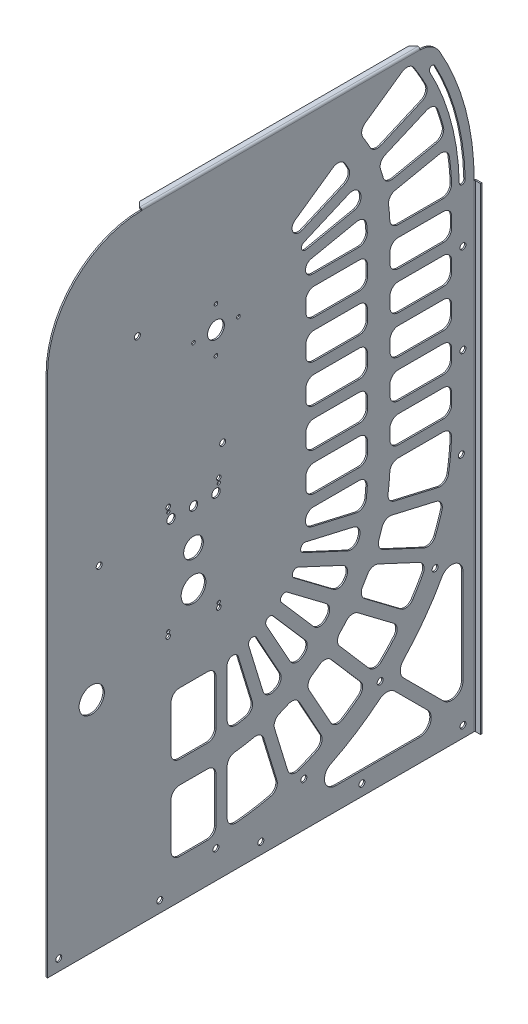
from build123d import *

# Parameters (mm, degrees)
SKETCH1_W             = 482.6
SKETCH1_H             = 698.5
BASE_FLANGE1_DEPTH    = 1.5875
SKETCH7_R             = 9.525
BEARING_HOLES_DEPTH   = 850.003845784
SKETCH9_R             = 3.3782
CUT_EXTRUDE2_DEPTH    = 850.003845784
CRVPATTERN1_START     = -1.5875
CRVPATTERN1_OUTLINE_R = 3.3782
CRVPATTERN1_DEPTH     = 1.5875
CUT_EXTRUDE3_DEPTH    = 850.003845784
CUT_EXTRUDE4_REACH    = 851.004
SKETCH12_R            = 4.7625
SKETCH13_R            = 3.3782
CUT_EXTRUDE5_DEPTH    = 850.003845784
CUT_EXTRUDE7_DEPTH    = 2.54
FILLET1_R             = 25.4
FILLET2_R             = 106.68
SKETCH26_R            = 3.3782
CUT_EXTRUDE9_DEPTH    = 850.003845784
CUT_EXTRUDE8_DEPTH    = 850.003845784
EDGE_FLANGE2_DEPTH    = 539.75
CUT_EXTRUDE10_DEPTH   = 850.039465459
SKETCH28_R            = 14.2875
CUT_EXTRUDE11_DEPTH   = 850.039465459
EDGE_FLANGE3_DEPTH    = 314.788975189
BREAK_CORNER1_START   = 699.2366
BREAK_CORNER1_DEPTH   = 1.5875


# Read off the part's stored shape, not the designer's step: CrvPattern1, Break-Corner1
# Sheet-metal steps are written as plain solids
with BuildPart() as part:
    # Sketch1 → Base-Flange1 (new body)
    with BuildSketch(Plane(origin=(0, 0, 0), x_dir=(0, 0, -1), z_dir=(1, 0, 0))):
        with Locations((-241.3, 349.25)):
            Rectangle(SKETCH1_W, SKETCH1_H)
    extrude(amount=-BASE_FLANGE1_DEPTH)

    # Sketch7 → Bearing Holes (cut, through all)
    with BuildSketch(Plane(origin=(0, 0, 0), x_dir=(0, 0, -1), z_dir=(1, 0, 0))):
        with Locations((-292.1, 539.75)):
            Circle(SKETCH7_R)
        with BuildLine():
            ThreePointArc((-315.4807, 539.75), (-317.5, 541.7693), (-319.5193, 539.75))
            ThreePointArc((-319.5193, 539.75), (-317.5, 537.7307), (-315.4807, 539.75))
        make_face()
        with BuildLine():
            ThreePointArc((-294.1193, 514.35), (-292.1, 512.3307), (-290.0807, 514.35))
            ThreePointArc((-290.0807, 514.35), (-292.1, 516.3693), (-294.1193, 514.35))
        make_face()
        with BuildLine():
            ThreePointArc((-268.7193, 539.75), (-266.7, 537.7307), (-264.6807, 539.75))
            ThreePointArc((-264.6807, 539.75), (-266.7, 541.7693), (-268.7193, 539.75))
        make_face()
        with BuildLine():
            ThreePointArc((-294.1193, 565.15), (-292.1, 563.1307), (-290.0807, 565.15))
            ThreePointArc((-290.0807, 565.15), (-292.1, 567.1693), (-294.1193, 565.15))
        make_face()
    extrude(amount=-BEARING_HOLES_DEPTH, mode=Mode.SUBTRACT)

    # Sketch9 → Cut-Extrude2 (cut, through all)
    with BuildSketch(Plane(origin=(0, 0, 0), x_dir=(0, 0, -1), z_dir=(1, 0, 0))):
        with Locations((-292.1, 31.75)):
            Circle(SKETCH9_R)
    extrude(amount=-CUT_EXTRUDE2_DEPTH, mode=Mode.SUBTRACT)

    # CrvPattern1 outline → CrvPattern1 (cut)
    with BuildSketch(Plane.YZ.offset(CRVPATTERN1_START)):
        with Locations((481.869506294, 12.7)):
            Circle(CRVPATTERN1_OUTLINE_R)
        with Locations((380.269506294, 12.7)):
            Circle(CRVPATTERN1_OUTLINE_R)
        with Locations((278.74261521, 14.58581764)):
            Circle(CRVPATTERN1_OUTLINE_R)
        with Locations((182.156845096, 44.259071201)):
            Circle(CRVPATTERN1_OUTLINE_R)
        with Locations((102.440892256, 106.345139108)):
            Circle(CRVPATTERN1_OUTLINE_R)
        with Locations((50.020066151, 192.724360892)):
            Circle(CRVPATTERN1_OUTLINE_R)
    extrude(amount=CRVPATTERN1_DEPTH, mode=Mode.SUBTRACT)

    # Sketch11 → Cut-Extrude3 (cut, through all)
    with BuildSketch(Plane(origin=(0, 0, 0), x_dir=(0, 0, -1), z_dir=(1, 0, 0))):
        with BuildLine():
            ThreePointArc((-10.148177306, 546.176984789), (-19.619450406, 612.499477987), (-44.466941645, 674.716680569))
            ThreePointArc((-44.466941645, 674.716680569), (-49.04986212, 676.066239905), (-50.399421456, 671.483319431))
            ThreePointArc((-50.399421456, 671.483319431), (-26.147195006, 610.756637946), (-16.902822694, 546.023015211))
            ThreePointArc((-16.902822694, 546.023015211), (-13.448515211, 542.722677306), (-10.148177306, 546.176984789))
        make_face()
    extrude(amount=-CUT_EXTRUDE3_DEPTH, mode=Mode.SUBTRACT)

    # Sketch12 → Cut-Extrude4 (cut, up to next)
    with BuildSketch(Plane(origin=(0, 0, 0), x_dir=(0, 0, -1), z_dir=(1, 0, 0)), mode=Mode.PRIVATE) as cut_extrude4_sk1:
        with Locations((-342.9, 379.8824)):
            Circle(SKETCH12_R)
    cut_extrude4_tool1 = extrude(cut_extrude4_sk1.sketch, amount=-CUT_EXTRUDE4_REACH, mode=Mode.PRIVATE) & part.part
    # Sketch12 → Cut-Extrude4 (cut, up to next)
    with BuildSketch(Plane(origin=(0, 0, 0), x_dir=(0, 0, -1), z_dir=(1, 0, 0)), mode=Mode.PRIVATE) as cut_extrude4_sk2:
        with Locations((-292.1, 379.8824)):
            Circle(SKETCH12_R)
    cut_extrude4_tool2 = extrude(cut_extrude4_sk2.sketch, amount=-CUT_EXTRUDE4_REACH, mode=Mode.PRIVATE) & part.part
    # Sketch12 → Cut-Extrude4 (cut, up to next)
    with BuildSketch(Plane(origin=(0, 0, 0), x_dir=(0, 0, -1), z_dir=(1, 0, 0)), mode=Mode.PRIVATE) as cut_extrude4_sk3:
        with Locations((-317.5, 379.8824)):
            Circle(SKETCH12_R)
    cut_extrude4_tool3 = extrude(cut_extrude4_sk3.sketch, amount=-CUT_EXTRUDE4_REACH, mode=Mode.PRIVATE) & part.part
    # Sketch12 → Cut-Extrude4 (cut, up to next)
    with BuildSketch(Plane(origin=(0, 0, 0), x_dir=(0, 0, -1), z_dir=(1, 0, 0)), mode=Mode.PRIVATE) as cut_extrude4_sk4:
        with BuildLine():
            ThreePointArc((-347.896015918, 388.0612), (-346.075, 386.240184083), (-344.253984083, 388.0612))
            ThreePointArc((-344.253984083, 388.0612), (-346.075, 389.882215918), (-347.896015918, 388.0612))
        make_face()
    cut_extrude4_tool4 = extrude(cut_extrude4_sk4.sketch, amount=-CUT_EXTRUDE4_REACH, mode=Mode.PRIVATE) & part.part
    # Sketch12 → Cut-Extrude4 (cut, up to next)
    with BuildSketch(Plane(origin=(0, 0, 0), x_dir=(0, 0, -1), z_dir=(1, 0, 0)), mode=Mode.PRIVATE) as cut_extrude4_sk5:
        with BuildLine():
            ThreePointArc((-348.6277, 393.1412), (-346.075, 390.5885), (-343.5223, 393.1412))
            ThreePointArc((-343.5223, 393.1412), (-346.075, 395.6939), (-348.6277, 393.1412))
        make_face()
    cut_extrude4_tool5 = extrude(cut_extrude4_sk5.sketch, amount=-CUT_EXTRUDE4_REACH, mode=Mode.PRIVATE) & part.part
    # Sketch12 → Cut-Extrude4 (cut, up to next)
    with BuildSketch(Plane(origin=(0, 0, 0), x_dir=(0, 0, -1), z_dir=(1, 0, 0)), mode=Mode.PRIVATE) as cut_extrude4_sk6:
        with BuildLine():
            ThreePointArc((-344.253984083, 271.2212), (-346.075, 273.042215918), (-347.896015918, 271.2212))
            ThreePointArc((-347.896015918, 271.2212), (-346.075, 269.400184083), (-344.253984083, 271.2212))
        make_face()
    cut_extrude4_tool6 = extrude(cut_extrude4_sk6.sketch, amount=-CUT_EXTRUDE4_REACH, mode=Mode.PRIVATE) & part.part
    # Sketch12 → Cut-Extrude4 (cut, up to next)
    with BuildSketch(Plane(origin=(0, 0, 0), x_dir=(0, 0, -1), z_dir=(1, 0, 0)), mode=Mode.PRIVATE) as cut_extrude4_sk7:
        with BuildLine():
            ThreePointArc((-343.5223, 266.1412), (-346.075, 268.6939), (-348.6277, 266.1412))
            ThreePointArc((-348.6277, 266.1412), (-346.075, 263.5885), (-343.5223, 266.1412))
        make_face()
    cut_extrude4_tool7 = extrude(cut_extrude4_sk7.sketch, amount=-CUT_EXTRUDE4_REACH, mode=Mode.PRIVATE) & part.part
    # Sketch12 → Cut-Extrude4 (cut, up to next)
    with BuildSketch(Plane(origin=(0, 0, 0), x_dir=(0, 0, -1), z_dir=(1, 0, 0)), mode=Mode.PRIVATE) as cut_extrude4_sk8:
        with BuildLine():
            ThreePointArc((-287.103984083, 271.2212), (-288.925, 273.042215918), (-290.746015918, 271.2212))
            ThreePointArc((-290.746015918, 271.2212), (-288.925, 269.400184083), (-287.103984083, 271.2212))
        make_face()
    cut_extrude4_tool8 = extrude(cut_extrude4_sk8.sketch, amount=-CUT_EXTRUDE4_REACH, mode=Mode.PRIVATE) & part.part
    # Sketch12 → Cut-Extrude4 (cut, up to next)
    with BuildSketch(Plane(origin=(0, 0, 0), x_dir=(0, 0, -1), z_dir=(1, 0, 0)), mode=Mode.PRIVATE) as cut_extrude4_sk9:
        with BuildLine():
            ThreePointArc((-291.4777, 266.1412), (-288.925, 263.5885), (-286.3723, 266.1412))
            ThreePointArc((-286.3723, 266.1412), (-288.925, 268.6939), (-291.4777, 266.1412))
        make_face()
    cut_extrude4_tool9 = extrude(cut_extrude4_sk9.sketch, amount=-CUT_EXTRUDE4_REACH, mode=Mode.PRIVATE) & part.part
    # Sketch12 → Cut-Extrude4 (cut, up to next)
    with BuildSketch(Plane(origin=(0, 0, 0), x_dir=(0, 0, -1), z_dir=(1, 0, 0)), mode=Mode.PRIVATE) as cut_extrude4_sk10:
        with BuildLine():
            ThreePointArc((-286.3723, 393.1412), (-288.925, 395.6939), (-291.4777, 393.1412))
            ThreePointArc((-291.4777, 393.1412), (-288.925, 390.5885), (-286.3723, 393.1412))
        make_face()
    cut_extrude4_tool10 = extrude(cut_extrude4_sk10.sketch, amount=-CUT_EXTRUDE4_REACH, mode=Mode.PRIVATE) & part.part
    # Sketch12 → Cut-Extrude4 (cut, up to next)
    with BuildSketch(Plane(origin=(0, 0, 0), x_dir=(0, 0, -1), z_dir=(1, 0, 0)), mode=Mode.PRIVATE) as cut_extrude4_sk11:
        with BuildLine():
            ThreePointArc((-290.746015918, 388.0612), (-288.925, 386.240184083), (-287.103984083, 388.0612))
            ThreePointArc((-287.103984083, 388.0612), (-288.925, 389.882215918), (-290.746015918, 388.0612))
        make_face()
    cut_extrude4_tool11 = extrude(cut_extrude4_sk11.sketch, amount=-CUT_EXTRUDE4_REACH, mode=Mode.PRIVATE) & part.part
    # Sketch12 → Cut-Extrude4 (cut, up to next)
    with BuildSketch(Plane(origin=(0, 0, 0), x_dir=(0, 0, -1), z_dir=(1, 0, 0)), mode=Mode.PRIVATE) as cut_extrude4_sk12:
        with BuildLine():
            ThreePointArc((-324.485, 310.548374891), (-329.598374891, 291.465), (-310.515, 286.351625109))
            ThreePointArc((-310.515, 286.351625109), (-305.401625109, 305.435), (-324.485, 310.548374891))
        make_face()
    cut_extrude4_tool12 = extrude(cut_extrude4_sk12.sketch, amount=-CUT_EXTRUDE4_REACH, mode=Mode.PRIVATE) & part.part
    # Sketch12 → Cut-Extrude4 (cut, up to next)
    with BuildSketch(Plane(origin=(0, 0, 0), x_dir=(0, 0, -1), z_dir=(1, 0, 0)), mode=Mode.PRIVATE) as cut_extrude4_sk13:
        with BuildLine():
            ThreePointArc((-328.448691084, 341.081764815), (-319.415564815, 328.217508917), (-306.551308917, 337.250635185))
            ThreePointArc((-306.551308917, 337.250635185), (-315.584435185, 350.114891084), (-328.448691084, 341.081764815))
        make_face()
    cut_extrude4_tool13 = extrude(cut_extrude4_sk13.sketch, amount=-CUT_EXTRUDE4_REACH, mode=Mode.PRIVATE) & part.part
    add(cut_extrude4_tool1.solids().sort_by_distance((0, 379.8824, 342.9))[0], mode=Mode.SUBTRACT)
    add(cut_extrude4_tool2.solids().sort_by_distance((0, 379.8824, 292.1))[0], mode=Mode.SUBTRACT)
    add(cut_extrude4_tool3.solids().sort_by_distance((0, 379.8824, 317.5))[0], mode=Mode.SUBTRACT)
    add(cut_extrude4_tool4.solids().sort_by_distance((0, 388.0612, 346.075))[0], mode=Mode.SUBTRACT)
    add(cut_extrude4_tool5.solids().sort_by_distance((0, 393.1412, 346.075))[0], mode=Mode.SUBTRACT)
    add(cut_extrude4_tool6.solids().sort_by_distance((0, 271.2212, 346.075))[0], mode=Mode.SUBTRACT)
    add(cut_extrude4_tool7.solids().sort_by_distance((0, 266.1412, 346.075))[0], mode=Mode.SUBTRACT)
    add(cut_extrude4_tool8.solids().sort_by_distance((0, 271.2212, 288.925))[0], mode=Mode.SUBTRACT)
    add(cut_extrude4_tool9.solids().sort_by_distance((0, 266.1412, 288.925))[0], mode=Mode.SUBTRACT)
    add(cut_extrude4_tool10.solids().sort_by_distance((0, 393.1412, 288.925))[0], mode=Mode.SUBTRACT)
    add(cut_extrude4_tool11.solids().sort_by_distance((0, 388.0612, 288.925))[0], mode=Mode.SUBTRACT)
    add(cut_extrude4_tool12.solids().sort_by_distance((0, 298.45, 317.5))[0], mode=Mode.SUBTRACT)
    add(cut_extrude4_tool13.solids().sort_by_distance((0, 339.1662, 317.5))[0], mode=Mode.SUBTRACT)

    # Sketch13 → Cut-Extrude5 (cut, through all)
    with BuildSketch(Plane.ZY.offset(1.5875)):
        with Locations((381, 577.85)):
            Circle(SKETCH13_R)
        with Locations((284.48, 425.45)):
            Circle(SKETCH13_R)
        with Locations((424.18, 374.65)):
            Circle(SKETCH13_R)
    extrude(amount=-CUT_EXTRUDE5_DEPTH, mode=Mode.SUBTRACT)

    # Sketch18 → Cut-Extrude7 (cut)
    with BuildSketch(Plane(origin=(0, 0, 0), x_dir=(0, 0, -1), z_dir=(1, 0, 0))):
        with BuildLine():
            Line((-46.904470881, 698.5), (0, 698.5))
            Line((0, 698.5), (0, 539.75))
            ThreePointArc((0, 539.75), (-11.971436608, 622.517130989), (-46.904470881, 698.5))
        make_face()
    extrude(amount=-CUT_EXTRUDE7_DEPTH, mode=Mode.SUBTRACT)

    # Fillet1
    fillet1_edges = [part.edges().sort_by_distance(p)[0] for p in [
        (-0.79375, 698.5, 46.904470881),
    ]]
    fillet(fillet1_edges, radius=FILLET1_R)

    # Fillet2
    fillet2_edges = [part.edges().sort_by_distance(p)[0] for p in [
        (-0.79375, 698.5, 482.6),
    ]]
    fillet(fillet2_edges, radius=FILLET2_R)

    # Sketch26 → Cut-Extrude9 (cut, through all)
    with BuildSketch(Plane.ZY.offset(1.5875)):
        with Locations((12.7, 12.7)):
            Circle(SKETCH26_R)
        with Locations((127, 12.7)):
            Circle(SKETCH26_R)
        with Locations((241.3, 12.7)):
            Circle(SKETCH26_R)
        with Locations((355.6, 12.7)):
            Circle(SKETCH26_R)
        with Locations((469.9, 12.7)):
            Circle(SKETCH26_R)
    extrude(amount=-CUT_EXTRUDE9_DEPTH, mode=Mode.SUBTRACT)

    # Sketch19 → Cut-Extrude8 (cut, through all)
    with BuildSketch(Plane(origin=(0, 0, 0), x_dir=(0, 0, -1), z_dir=(1, 0, 0))):
        with BuildLine():
            Line((-156.649870801, 25.4), (-61.321024484, 25.4))
            ThreePointArc((-61.321024484, 25.4), (-49.587754421, 33.239920409), (-52.340768363, 47.080256121))
            Line((-52.340768363, 47.080256121), (-89.767936864, 84.507424621))
            ThreePointArc((-89.767936864, 84.507424621), (-98.124730264, 88.211855892), (-106.804518277, 85.34478648))
            ThreePointArc((-106.804518277, 85.34478648), (-133.53166182, 65.836950761), (-162.293626184, 49.477083333))
            ThreePointArc((-162.293626184, 49.477083333), (-169.014719331, 35.2016348), (-156.649870801, 25.4))
        make_face()
        with BuildLine():
            Line((-12.7, 163.589334509), (-12.7, 56.060512242))
            ThreePointArc((-12.7, 56.060512242), (-20.539920409, 44.327242179), (-34.380256121, 47.080256121))
            Line((-34.380256121, 47.080256121), (-79.827050366, 92.527050366))
            ThreePointArc((-79.827050366, 92.527050366), (-83.545642238, 101.336251972), (-80.065677818, 110.242418717))
            ThreePointArc((-80.065677818, 110.242418717), (-56.404297585, 138.610306414), (-36.5125, 169.737695572))
            ThreePointArc((-36.5125, 169.737695572), (-22.225, 175.886056634), (-12.7, 163.589334509))
        make_face()
    extrude(amount=-CUT_EXTRUDE8_DEPTH, mode=Mode.SUBTRACT)

    # Edge-Flange2 section (across the edge) → Edge-Flange2 (add)
    with BuildSketch(Plane(origin=(0, 0, -0.7366), x_dir=(0, 0, 1), z_dir=(0, 1, 0))):
        with BuildLine():
            Line((-1.5875, 0.7366), (-1.5875, 6.35))
            Line((-1.5875, 6.35), (0, 6.35))
            Line((0, 6.35), (0, 0.7366))
            ThreePointArc((0, 0.7366), (0.215745145, 0.215745145), (0.7366, 0))
            Line((0.7366, 0), (0.7366, -1.5875))
            ThreePointArc((0.7366, -1.5875), (-0.90678687, -0.90678687), (-1.5875, 0.7366))
        make_face()
    extrude(amount=EDGE_FLANGE2_DEPTH)

    # Sketch27 → Cut-Extrude10 (cut, through all)
    with BuildSketch(Plane.ZY.offset(1.5875)):
        with BuildLine():
            Line((333.375, 114.3), (301.625, 114.3))
            ThreePointArc((301.625, 114.3), (294.889807909, 111.510192091), (292.1, 104.775))
            Line((292.1, 104.775), (292.1, 53.975))
            ThreePointArc((292.1, 53.975), (294.889807909, 47.239807909), (301.625, 44.45))
            Line((301.625, 44.45), (333.375, 44.45))
            ThreePointArc((333.375, 44.45), (340.110192091, 47.239807909), (342.9, 53.975))
            Line((342.9, 53.975), (342.9, 104.775))
            ThreePointArc((342.9, 104.775), (340.110192091, 111.510192091), (333.375, 114.3))
        make_face()
        with BuildLine():
            Line((279.4, 54.937139277), (279.4, 105.975220848))
            ThreePointArc((279.4, 105.975220848), (276.963585082, 112.337420667), (270.900769231, 115.44482604))
            ThreePointArc((270.900769231, 115.44482604), (259.999148252, 116.935021646), (249.197819666, 119.032001305))
            ThreePointArc((249.197819666, 119.032001305), (242.329800372, 117.967696281), (238.013104914, 112.520809597))
            Line((238.013104914, 112.520809597), (223.125231873, 63.824771077))
            ThreePointArc((223.125231873, 63.824771077), (223.966051137, 56.31065229), (230.016776699, 51.776594685))
            ThreePointArc((230.016776699, 51.776594685), (249.416852344, 47.887699421), (269.051851852, 45.447774065))
            ThreePointArc((269.051851852, 45.447774065), (276.312590345, 47.916950137), (279.4, 54.937139277))
        make_face()
        with BuildLine():
            Line((210.980161472, 67.537891727), (225.868034514, 116.233930247))
            ThreePointArc((225.868034514, 116.233930247), (225.335192169, 123.163469428), (220.236497942, 127.886365932))
            ThreePointArc((220.236497942, 127.886365932), (215.184577357, 129.948619598), (210.191757295, 132.150105371))
            ThreePointArc((210.191757295, 132.150105371), (203.252539243, 132.53699947), (197.897702518, 128.10663178))
            Line((197.897702518, 128.10663178), (173.210689518, 83.570081393))
            ThreePointArc((173.210689518, 83.570081393), (172.470861722, 76.045347975), (177.44668083, 70.352353825))
            ThreePointArc((177.44668083, 70.352353825), (187.892008032, 65.651355584), (198.529557141, 61.403203778))
            ThreePointArc((198.529557141, 61.403203778), (206.081248809, 61.778585093), (210.980161472, 67.537891727))
        make_face()
        with BuildLine():
            Line((301.625, 139.7), (333.375, 139.7))
            ThreePointArc((333.375, 139.7), (340.110192091, 142.489807909), (342.9, 149.225))
            Line((342.9, 149.225), (342.9, 200.025))
            ThreePointArc((342.9, 200.025), (340.110192091, 206.760192091), (333.375, 209.55))
            Line((333.375, 209.55), (301.625, 209.55))
            ThreePointArc((301.625, 209.55), (294.889807909, 206.760192091), (292.1, 200.025))
            Line((292.1, 200.025), (292.1, 149.225))
            ThreePointArc((292.1, 149.225), (294.889807909, 142.489807909), (301.625, 139.7))
        make_face()
        with BuildLine():
            Line((279.4, 150.757497058), (279.4, 204.821575064))
            ThreePointArc((279.4, 204.821575064), (273.914615259, 211.187677432), (266.807647542, 206.703514748))
            Line((266.807647542, 206.703514748), (251.058315916, 155.189772161))
            ThreePointArc((251.058315916, 155.189772161), (251.986644049, 147.525847824), (258.288713935, 143.066986478))
            ThreePointArc((258.288713935, 143.066986478), (263.414918227, 142.116664283), (268.567647059, 141.322643944))
            ThreePointArc((268.567647059, 141.322643944), (276.130920725, 143.574943133), (279.4, 150.757497058))
        make_face()
        with BuildLine():
            Line((238.913245515, 158.902892811), (255.098677828, 211.843056471))
            ThreePointArc((255.098677828, 211.843056471), (252.401717345, 217.626706889), (246.367841235, 215.549076729))
            Line((246.367841235, 215.549076729), (219.529220513, 167.130923261))
            ThreePointArc((219.529220513, 167.130923261), (218.843842981, 159.441463788), (224.081148119, 153.769765254))
            ThreePointArc((224.081148119, 153.769765254), (225.109148021, 153.329442876), (226.139998169, 152.895835257))
            ThreePointArc((226.139998169, 152.895835257), (233.858014512, 153.068326087), (238.913245515, 158.902892811))
        make_face()
        with BuildLine():
            Line((162.103019238, 89.72716357), (186.790032238, 134.263713957))
            ThreePointArc((186.790032238, 134.263713957), (187.709565985, 141.152610234), (183.704235857, 146.832378255))
            ThreePointArc((183.704235857, 146.832378255), (179.191478504, 149.899920082), (174.76547817, 153.09136377))
            ThreePointArc((174.76547817, 153.09136377), (168.058338487, 154.912547862), (161.899392555, 151.692327494))
            Line((161.899392555, 151.692327494), (128.492180526, 113.261726202))
            ThreePointArc((128.492180526, 113.261726202), (126.204039694, 106.055245111), (129.887485176, 99.452125578))
            ThreePointArc((129.887485176, 99.452125578), (139.127164425, 92.682149788), (148.649017139, 86.31515947))
            ThreePointArc((148.649017139, 86.31515947), (156.11373239, 85.112252819), (162.103019238, 89.72716357))
        make_face()
        with BuildLine():
            Line((208.421550232, 173.288005439), (235.260170954, 221.706158906))
            ThreePointArc((235.260170954, 221.706158906), (233.824634067, 227.9241523), (227.490649026, 227.146436728))
            Line((227.490649026, 227.146436728), (191.171816407, 185.366399095))
            ThreePointArc((191.171816407, 185.366399095), (188.902687498, 177.987470761), (192.84633252, 171.350815482))
            ThreePointArc((192.84633252, 171.350815482), (193.760319988, 170.706382007), (194.678491494, 170.067923958))
            ThreePointArc((194.678491494, 170.067923958), (202.263713522, 168.631979621), (208.421550232, 173.288005439))
        make_face()
        with BuildLine():
            Line((118.907368857, 121.59367587), (152.314580886, 160.024277162))
            ThreePointArc((152.314580886, 160.024277162), (154.646302687, 166.57145271), (151.909388806, 172.959859133))
            ThreePointArc((151.909388806, 172.959859133), (148.133023836, 176.898622822), (144.467280681, 180.940543022))
            ThreePointArc((144.467280681, 180.940543022), (138.285353557, 184.116422624), (131.591473909, 182.247088659))
            Line((131.591473909, 182.247088659), (90.924118321, 151.602038149))
            ThreePointArc((90.924118321, 151.602038149), (87.187667188, 145.028767189), (89.417754803, 137.804110283))
            ThreePointArc((89.417754803, 137.804110283), (97.047967778, 129.261037371), (105.037973442, 121.05347657))
            ThreePointArc((105.037973442, 121.05347657), (112.089468399, 118.324854747), (118.907368857, 121.59367587))
        make_face()
        with BuildLine():
            Line((181.587004738, 193.698348764), (217.905837358, 235.478386396))
            ThreePointArc((217.905837358, 235.478386396), (217.794463915, 241.858966618), (211.437195486, 242.415155536))
            Line((211.437195486, 242.415155536), (167.22545823, 209.099221866))
            ThreePointArc((167.22545823, 209.099221866), (163.471749766, 202.353319248), (165.949378463, 195.041760905))
            ThreePointArc((165.949378463, 195.041760905), (166.709407857, 194.221381167), (167.474772221, 193.405976368))
            ThreePointArc((167.474772221, 193.405976368), (174.595689334, 190.424354523), (181.587004738, 193.698348764))
        make_face()
        with BuildLine():
            Line((83.281067527, 161.744709126), (123.948423115, 192.389759637))
            ThreePointArc((123.948423115, 192.389759637), (127.590425539, 198.309071468), (126.241544173, 205.126912276))
            ThreePointArc((126.241544173, 205.126912276), (123.366616857, 209.764754954), (120.621341448, 214.480500357))
            ThreePointArc((120.621341448, 214.480500357), (115.234806761, 218.872274291), (108.298548059, 218.435525594))
            Line((108.298548059, 218.435525594), (62.148407496, 196.915361625))
            ThreePointArc((62.148407496, 196.915361625), (57.126946905, 191.262584279), (57.806211122, 183.732142174))
            ThreePointArc((57.806211122, 183.732142174), (63.493480903, 173.789345421), (69.602437929, 164.099923929))
            ThreePointArc((69.602437929, 164.099923929), (75.932528426, 159.964840799), (83.281067527, 161.744709126))
        make_face()
        with BuildLine():
            Line((159.582407436, 219.241892843), (203.794144692, 252.557826514))
            ThreePointArc((203.794144692, 252.557826514), (205.011802249, 258.822131589), (198.909093565, 260.687916874))
            Line((198.909093565, 260.687916874), (148.736716744, 237.292153334))
            ThreePointArc((148.736716744, 237.292153334), (143.662483797, 231.474104748), (144.565811904, 223.807193525))
            ThreePointArc((144.565811904, 223.807193525), (145.138666295, 222.846722057), (145.71777342, 221.89000761))
            ThreePointArc((145.71777342, 221.89000761), (152.06316737, 217.493019439), (159.582407436, 219.241892843))
        make_face()
        with BuildLine():
            Line((56.781155572, 208.42547052), (102.931296135, 229.94563449))
            ThreePointArc((102.931296135, 229.94563449), (107.724406198, 234.978380274), (107.822509937, 241.927683108))
            ThreePointArc((107.822509937, 241.927683108), (105.974668393, 247.061908795), (104.269842439, 252.245378699))
            ThreePointArc((104.269842439, 252.245378699), (99.914117603, 257.66110537), (93.038627635, 258.676029955))
            Line((93.038627635, 258.676029955), (43.422684692, 247.221286956))
            ThreePointArc((43.422684692, 247.221286956), (37.335676568, 242.73605672), (36.434430281, 235.22894587))
            ThreePointArc((36.434430281, 235.22894587), (39.930195888, 224.320973206), (43.891113541, 213.573165236))
            ThreePointArc((43.891113541, 213.573165236), (49.223144248, 208.212343776), (56.781155572, 208.42547052))
        make_face()
        with BuildLine():
            Line((143.36946482, 248.80226223), (193.541841641, 272.198025769))
            ThreePointArc((193.541841641, 272.198025769), (196.035312719, 278.072275507), (190.453881436, 281.166113388))
            Line((190.453881436, 281.166113388), (136.51363867, 268.713027111))
            ThreePointArc((136.51363867, 268.713027111), (130.340649568, 264.077109197), (129.630197313, 256.389925906))
            ThreePointArc((129.630197313, 256.389925906), (129.990840213, 255.331339918), (130.35838034, 254.275128836))
            ThreePointArc((130.35838034, 254.275128836), (135.650926963, 248.654943821), (143.36946482, 248.80226223))
        make_face()
        with BuildLine():
            Line((40.565806302, 259.595786779), (90.181749245, 271.050529777))
            ThreePointArc((90.181749245, 271.050529777), (95.91648504, 274.976754374), (97.457286278, 281.753801353))
            ThreePointArc((97.457286278, 281.753801353), (96.195132975, 291.88330397), (95.459774496, 302.064615385))
            ThreePointArc((95.459774496, 302.064615385), (92.522853441, 308.513866436), (85.944924875, 311.15))
            Line((85.944924875, 311.15), (35.10144942, 311.15))
            ThreePointArc((35.10144942, 311.15), (28.242665515, 308.234289548), (25.582984584, 301.272222222))
            ThreePointArc((25.582984584, 301.272222222), (26.761442787, 284.236433609), (29.027708528, 267.310982448))
            ThreePointArc((29.027708528, 267.310982448), (33.128644118, 260.958716279), (40.565806302, 259.595786779))
        make_face()
        with BuildLine():
            Line((133.656760279, 281.087526934), (183.62473629, 292.62354317))
            ThreePointArc((183.62473629, 292.62354317), (190.837072188, 302.828762421), (181.513913161, 311.15))
            Line((181.513913161, 311.15), (130.455389821, 311.15))
            ThreePointArc((130.455389821, 311.15), (123.524934335, 308.159096094), (120.94688334, 301.064705882))
            ThreePointArc((120.94688334, 301.064705882), (121.403318948, 295.09554337), (122.067872162, 289.145954848))
            ThreePointArc((122.067872162, 289.145954848), (126.076261774, 282.548202043), (133.656760279, 281.087526934))
        make_face()
        with BuildLine():
            Line((130.175, 323.85), (180.975, 323.85))
            ThreePointArc((180.975, 323.85), (187.710192091, 326.639807909), (190.5, 333.375))
            Line((190.5, 333.375), (190.5, 344.805))
            ThreePointArc((190.5, 344.805), (187.710192091, 351.540192091), (180.975, 354.33))
            Line((180.975, 354.33), (130.175, 354.33))
            ThreePointArc((130.175, 354.33), (123.439807909, 351.540192091), (120.65, 344.805))
            Line((120.65, 344.805), (120.65, 333.375))
            ThreePointArc((120.65, 333.375), (123.439807909, 326.639807909), (130.175, 323.85))
        make_face()
        with BuildLine():
            Line((34.925, 323.85), (85.725, 323.85))
            ThreePointArc((85.725, 323.85), (92.460192091, 326.639807909), (95.25, 333.375))
            Line((95.25, 333.375), (95.25, 344.805))
            ThreePointArc((95.25, 344.805), (92.460192091, 351.540192091), (85.725, 354.33))
            Line((85.725, 354.33), (34.925, 354.33))
            ThreePointArc((34.925, 354.33), (28.189807909, 351.540192091), (25.4, 344.805))
            Line((25.4, 344.805), (25.4, 333.375))
            ThreePointArc((25.4, 333.375), (28.189807909, 326.639807909), (34.925, 323.85))
        make_face()
        with BuildLine():
            Line((95.25, 376.555), (95.25, 387.985))
            ThreePointArc((95.25, 387.985), (92.460192091, 394.720192091), (85.725, 397.51))
            Line((85.725, 397.51), (34.925, 397.51))
            ThreePointArc((34.925, 397.51), (28.189807909, 394.720192091), (25.4, 387.985))
            Line((25.4, 387.985), (25.4, 376.555))
            ThreePointArc((25.4, 376.555), (28.189807909, 369.819807909), (34.925, 367.03))
            Line((34.925, 367.03), (85.725, 367.03))
            ThreePointArc((85.725, 367.03), (92.460192091, 369.819807909), (95.25, 376.555))
        make_face()
        with BuildLine():
            Line((120.65, 387.985), (120.65, 376.555))
            ThreePointArc((120.65, 376.555), (123.439807909, 369.819807909), (130.175, 367.03))
            Line((130.175, 367.03), (180.975, 367.03))
            ThreePointArc((180.975, 367.03), (187.710192091, 369.819807909), (190.5, 376.555))
            Line((190.5, 376.555), (190.5, 387.985))
            ThreePointArc((190.5, 387.985), (187.710192091, 394.720192091), (180.975, 397.51))
            Line((180.975, 397.51), (130.175, 397.51))
            ThreePointArc((130.175, 397.51), (123.439807909, 394.720192091), (120.65, 387.985))
        make_face()
        with BuildLine():
            Line((95.25, 419.735), (95.25, 431.165))
            ThreePointArc((95.25, 431.165), (92.460192091, 437.900192091), (85.725, 440.69))
            Line((85.725, 440.69), (34.925, 440.69))
            ThreePointArc((34.925, 440.69), (28.189807909, 437.900192091), (25.4, 431.165))
            Line((25.4, 431.165), (25.4, 419.735))
            ThreePointArc((25.4, 419.735), (28.189807909, 412.999807909), (34.925, 410.21))
            Line((34.925, 410.21), (85.725, 410.21))
            ThreePointArc((85.725, 410.21), (92.460192091, 412.999807909), (95.25, 419.735))
        make_face()
        with BuildLine():
            Line((120.65, 431.165), (120.65, 419.735))
            ThreePointArc((120.65, 419.735), (123.439807909, 412.999807909), (130.175, 410.21))
            Line((130.175, 410.21), (180.975, 410.21))
            ThreePointArc((180.975, 410.21), (187.710192091, 412.999807909), (190.5, 419.735))
            Line((190.5, 419.735), (190.5, 431.165))
            ThreePointArc((190.5, 431.165), (187.710192091, 437.900192091), (180.975, 440.69))
            Line((180.975, 440.69), (130.175, 440.69))
            ThreePointArc((130.175, 440.69), (123.439807909, 437.900192091), (120.65, 431.165))
        make_face()
        with BuildLine():
            Line((95.25, 462.915), (95.25, 474.345))
            ThreePointArc((95.25, 474.345), (92.460192091, 481.080192091), (85.725, 483.87))
            Line((85.725, 483.87), (34.925, 483.87))
            ThreePointArc((34.925, 483.87), (28.189807909, 481.080192091), (25.4, 474.345))
            Line((25.4, 474.345), (25.4, 462.915))
            ThreePointArc((25.4, 462.915), (28.189807909, 456.179807909), (34.925, 453.39))
            Line((34.925, 453.39), (85.725, 453.39))
            ThreePointArc((85.725, 453.39), (92.460192091, 456.179807909), (95.25, 462.915))
        make_face()
        with BuildLine():
            Line((120.65, 474.345), (120.65, 462.915))
            ThreePointArc((120.65, 462.915), (123.439807909, 456.179807909), (130.175, 453.39))
            Line((130.175, 453.39), (180.975, 453.39))
            ThreePointArc((180.975, 453.39), (187.710192091, 456.179807909), (190.5, 462.915))
            Line((190.5, 462.915), (190.5, 474.345))
            ThreePointArc((190.5, 474.345), (187.710192091, 481.080192091), (180.975, 483.87))
            Line((180.975, 483.87), (130.175, 483.87))
            ThreePointArc((130.175, 483.87), (123.439807909, 481.080192091), (120.65, 474.345))
        make_face()
        with BuildLine():
            Line((95.25, 506.095), (95.25, 517.525))
            ThreePointArc((95.25, 517.525), (92.460192091, 524.260192091), (85.725, 527.05))
            Line((85.725, 527.05), (34.925, 527.05))
            ThreePointArc((34.925, 527.05), (28.189807909, 524.260192091), (25.4, 517.525))
            Line((25.4, 517.525), (25.4, 506.095))
            ThreePointArc((25.4, 506.095), (28.189807909, 499.359807909), (34.925, 496.57))
            Line((34.925, 496.57), (85.725, 496.57))
            ThreePointArc((85.725, 496.57), (92.460192091, 499.359807909), (95.25, 506.095))
        make_face()
        with BuildLine():
            Line((120.65, 517.525), (120.65, 506.095))
            ThreePointArc((120.65, 506.095), (123.439807909, 499.359807909), (130.175, 496.57))
            Line((130.175, 496.57), (180.975, 496.57))
            ThreePointArc((180.975, 496.57), (187.710192091, 499.359807909), (190.5, 506.095))
            Line((190.5, 506.095), (190.5, 517.525))
            ThreePointArc((190.5, 517.525), (187.710192091, 524.260192091), (180.975, 527.05))
            Line((180.975, 527.05), (130.175, 527.05))
            ThreePointArc((130.175, 527.05), (123.439807909, 524.260192091), (120.65, 517.525))
        make_face()
        with BuildLine():
            Line((35.10144942, 539.75), (85.944924875, 539.75))
            ThreePointArc((85.944924875, 539.75), (92.522853441, 542.386133564), (95.459774496, 548.835384615))
            ThreePointArc((95.459774496, 548.835384615), (95.984221037, 556.735986629), (96.825968646, 564.609106553))
            ThreePointArc((96.825968646, 564.609106553), (95.127889782, 571.34846575), (89.303347569, 575.140185969))
            Line((89.303347569, 575.140185969), (39.434298666, 585.437316283))
            ThreePointArc((39.434298666, 585.437316283), (32.030864105, 583.901700806), (28.078849485, 577.455730078))
            ThreePointArc((28.078849485, 577.455730078), (26.466257585, 563.574459918), (25.582984584, 549.627777778))
            ThreePointArc((25.582984584, 549.627777778), (28.242665515, 542.665710452), (35.10144942, 539.75))
        make_face()
        with BuildLine():
            Line((130.455389821, 539.75), (182.834293733, 539.75))
            ThreePointArc((182.834293733, 539.75), (190.747995805, 546.896398191), (184.442913191, 555.49544586))
            Line((184.442913191, 555.49544586), (133.00013781, 566.117524553))
            ThreePointArc((133.00013781, 566.117524553), (125.455680177, 564.480854646), (121.601898694, 557.791617198))
            ThreePointArc((121.601898694, 557.791617198), (121.228075876, 553.817268616), (120.94688334, 549.835294118))
            ThreePointArc((120.94688334, 549.835294118), (123.524934335, 542.740903906), (130.455389821, 539.75))
        make_face()
        with BuildLine():
            Line((135.568300978, 578.55515045), (190.086242045, 567.298101119))
            ThreePointArc((190.086242045, 567.298101119), (195.202357804, 570.30170923), (192.734279957, 575.696604399))
            Line((192.734279957, 575.696604399), (141.619018843, 597.745575781))
            ThreePointArc((141.619018843, 597.745575781), (133.899461599, 597.668340364), (128.772615488, 591.896600737))
            ThreePointArc((128.772615488, 591.896600737), (128.585228794, 591.306009325), (128.39997767, 590.71474457))
            ThreePointArc((128.39997767, 590.71474457), (129.289110296, 583.046174134), (135.568300978, 578.55515045))
        make_face()
        with BuildLine():
            Line((146.649231872, 609.406920338), (194.881260533, 588.601654035))
            ThreePointArc((194.881260533, 588.601654035), (204.978292963, 592.029134696), (202.594773341, 602.422234416))
            Line((202.594773341, 602.422234416), (159.688487123, 632.465539462))
            ThreePointArc((159.688487123, 632.465539462), (152.295878341, 633.990680373), (146.114887542, 629.658005431))
            ThreePointArc((146.114887542, 629.658005431), (144.061260241, 626.234877467), (142.08788527, 622.764865742))
            ThreePointArc((142.08788527, 622.764865742), (141.407929272, 615.074924962), (146.649231872, 609.406920338))
        make_face()
        with BuildLine():
            Line((58.92320617, 647.248234028), (105.679730836, 627.079438021))
            ThreePointArc((105.679730836, 627.079438021), (112.625757868, 626.844613224), (117.882280272, 631.391195064))
            ThreePointArc((117.882280272, 631.391195064), (121.708597066, 638.323283938), (125.810594758, 645.095888407))
            ThreePointArc((125.810594758, 645.095888407), (127.103948308, 652.063354302), (123.22764877, 657.995693326))
            Line((123.22764877, 657.995693326), (81.579111913, 687.158312789))
            ThreePointArc((81.579111913, 687.158312789), (74.288342245, 688.703939442), (68.116381407, 684.526478069))
            ThreePointArc((68.116381407, 684.526478069), (60.840428051, 672.595400304), (54.199416532, 660.299584759))
            ThreePointArc((54.199416532, 660.299584759), (53.739460468, 652.752572198), (58.92320617, 647.248234028))
        make_face()
        with BuildLine():
            Line((42.002461834, 597.874942179), (91.871510738, 587.577811866))
            ThreePointArc((91.871510738, 587.577811866), (98.721522871, 588.752447127), (102.950050048, 594.268060613))
            ThreePointArc((102.950050048, 594.268060613), (104.360818245, 598.943936632), (105.887156896, 603.583373428))
            ThreePointArc((105.887156896, 603.583373428), (105.586976142, 610.526883039), (100.649517808, 615.418093463))
            Line((100.649517808, 615.418093463), (53.892993141, 635.586889471))
            ThreePointArc((53.892993141, 635.586889471), (46.331980502, 635.580103418), (41.158123495, 630.06646924))
            ThreePointArc((41.158123495, 630.06646924), (37.743689235, 619.948236728), (34.737050292, 609.701426846))
            ThreePointArc((34.737050292, 609.701426846), (35.812735194, 602.217319673), (42.002461834, 597.874942179))
        make_face()
    extrude(amount=-CUT_EXTRUDE10_DEPTH, mode=Mode.SUBTRACT)

    # Sketch28 → Cut-Extrude11 (cut, through all)
    with BuildSketch(Plane.ZY.offset(1.5875)):
        with Locations((432.643923389, 247.65)):
            Circle(SKETCH28_R)
    extrude(amount=-CUT_EXTRUDE11_DEPTH, mode=Mode.SUBTRACT)

    # Edge-Flange3 section (across the edge) → Edge-Flange3 (add)
    with BuildSketch(Plane(origin=(-1.5875, 699.2366, 375.92), x_dir=(0, -1, 0), z_dir=(0, 0, -1))):
        with BuildLine():
            Line((-1.5875, 0.7366), (-1.5875, 6.35))
            Line((-1.5875, 6.35), (0, 6.35))
            Line((0, 6.35), (0, 0.7366))
            ThreePointArc((0, 0.7366), (0.215745145, 0.215745145), (0.7366, 0))
            Line((0.7366, 0), (0.7366, -1.5875))
            ThreePointArc((0.7366, -1.5875), (-0.90678687, -0.90678687), (-1.5875, 0.7366))
        make_face()
    extrude(amount=EDGE_FLANGE3_DEPTH)

    # Break-Corner1 outline → Break-Corner1 (cut)
    with BuildSketch(Plane(origin=(0, 0, 0), x_dir=(1, 0, 0), z_dir=(0, 1, 0)).offset(BREAK_CORNER1_START)):
        Polygon((-7.9375, -375.92), (-2.8575, -375.92), (-7.9375, -370.84), align=None)
        Polygon((-7.9375, -61.131024811), (-7.9375, -66.211024811), (-2.8575, -61.131024811), align=None)
    extrude(amount=BREAK_CORNER1_DEPTH, mode=Mode.SUBTRACT)


solid = part.part
